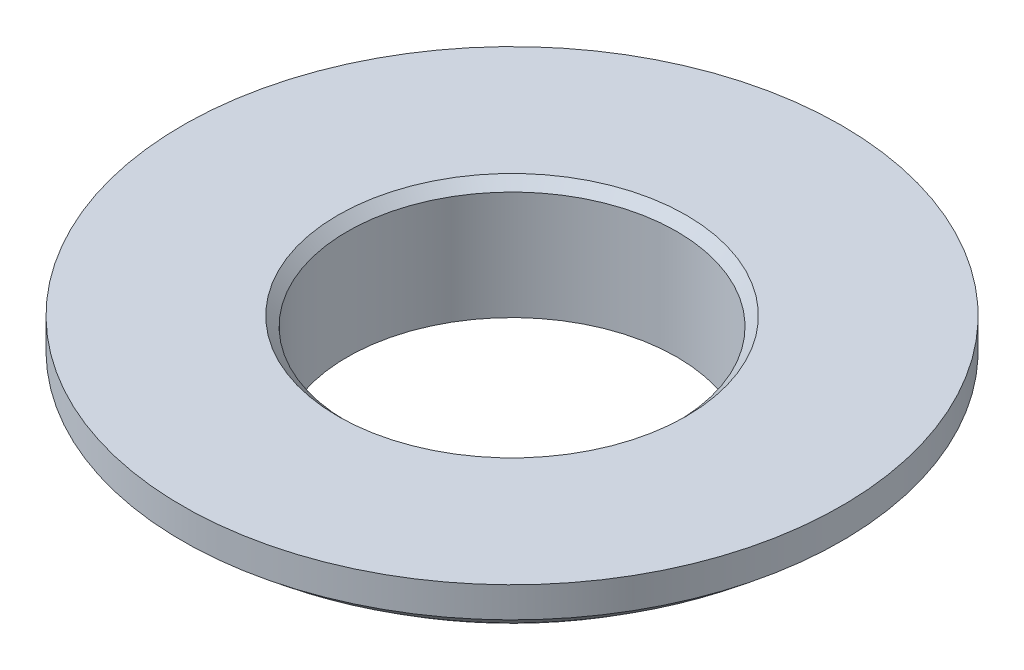
from build123d import *

# Parameters (mm, degrees)
CHAMFER_1_SIZE   = 0.23585869
CHAMFER_1_SIZE_2 = 0.3


with BuildPart() as part:
    # 草图1 → 旋转1 (revolve)
    with BuildSketch(Plane(origin=(0, 0, 0), x_dir=(0, 0, -1), z_dir=(1, 0, 0)), mode=Mode.PRIVATE) as revolve_1_sk:
        with BuildLine():
            Line((-5.25, 2.439482462), (-10.5, 2.439482462))
            Line((-10.5, 2.439482462), (-10.5, 1.470571375))
            ThreePointArc((-10.5, 1.470571375), (-8.019866328, -0.295888922), (-5.25, -1.560517538))
            Line((-5.25, -1.560517538), (-5.25, 2.439482462))
        make_face()
    revolve(revolve_1_sk.sketch.rotate(Axis((0, -2.439482462, 0), (0, 1, 0)), 180), axis=Axis((0, -2.439482462, 0), (0, 1, 0)))

    # 倒角1
    # the kernel refuses this chamfer: 0.3, 0.23585869 mm, written as the material it takes off along each edge
    with BuildSketch(Plane(origin=(0, -1.560517538, 0), x_dir=(0, 0, -1), z_dir=(1, 0, 0))) as chamfer_1_piece_1:
        with BuildLine():
            Line((5.25, CHAMFER_1_SIZE), (5.5300073, 0.099771931))
            ThreePointArc((5.5300073, 0.099771931), (5.394193497, 0.050646644), (5.25, 0))
            Line((5.25, 0), (5.25, CHAMFER_1_SIZE))
        make_face()
    revolve(axis=Axis((0, -1.560517538, 0), (0, 1, 0)), mode=Mode.SUBTRACT)
    with BuildSketch(Plane(origin=(0, 2.439482462, 0), x_dir=(0, 0, -1), z_dir=(1, 0, 0))) as chamfer_1_piece_2:
        Polygon((5.25, -CHAMFER_1_SIZE_2), (5.25 + CHAMFER_1_SIZE_2, 0), (5.25, 0), align=None)
    revolve(axis=Axis((0, 2.439482462, 0), (0, 1, 0)), mode=Mode.SUBTRACT)


solid = part.part
